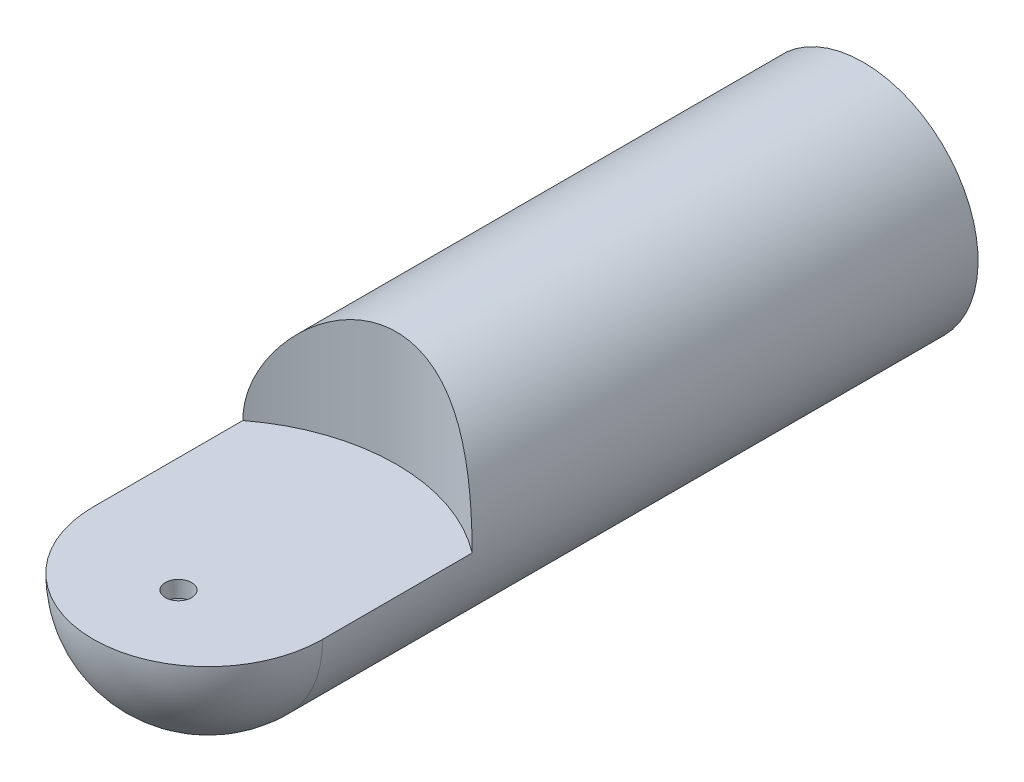
from build123d import *

# Parameters (mm, degrees)
REVOLVE1_ANGLE      = 90
SHELL2_T            = -5
SKETCH3_R           = 4
CUT_EXTRUDE1_DEPTH  = 7
SKETCH4_R           = 35
SKETCH4_R_2         = 30
BOSS_EXTRUDE1_DEPTH = 200
BOSS_EXTRUDE3_REACH = 208.034
CUT_EXTRUDE3_DEPTH  = 80
SKETCH6_W           = 60
SKETCH6_H           = 5
BOSS_EXTRUDE4_DEPTH = 60
CUT_EXTRUDE4_DEPTH  = 113
BOSS_EXTRUDE5_REACH = 208.034


with BuildPart() as part:
    # Sketch1 → Revolve1 (revolve)
    with BuildSketch(Plane(origin=(0, 0, 0), x_dir=(1, 0, 0), z_dir=(0, 1, 0))):
        with BuildLine():
            Line((-35, 0), (35, 0))
            ThreePointArc((35, 0), (0, -35), (-35, 0))
        make_face()
    revolve(axis=Axis((-35, 0, 0), (1, 0, 0)), revolution_arc=REVOLVE1_ANGLE)

    # Shell2
    shell2_openings = [part.faces().sort_by_distance(p)[0] for p in [
        (0, -14.854461355, 0),
    ]]
    offset(amount=SHELL2_T, openings=shell2_openings, kind=Kind.INTERSECTION)

    # Sketch3 → Cut-Extrude1 (cut)
    with BuildSketch(Plane(origin=(0, 0, 0), x_dir=(1, 0, 0), z_dir=(0, 1, 0))):
        with Locations(Location((0, -9, 0), (0, 0, 270))):
            Circle(SKETCH3_R)
    extrude(amount=-CUT_EXTRUDE1_DEPTH, mode=Mode.SUBTRACT)

    # Sketch4 → Boss-Extrude1 (add)
    with BuildSketch(Plane(origin=(0, 0, 0), x_dir=(-1, 0, 0), z_dir=(0, 0, -1))):
        Circle(SKETCH4_R)
        with Locations(Location((0, 0, 0), (0, 0, 189.594068227))):
            Circle(SKETCH4_R_2, mode=Mode.SUBTRACT)
    extrude(amount=BOSS_EXTRUDE1_DEPTH)

    # Sketch5 → Boss-Extrude3 (add, up to next)
    with BuildSketch(Plane(origin=(0, 0, 0), x_dir=(1, 0, 0), z_dir=(0, 1, 0)), mode=Mode.PRIVATE) as boss_extrude3_sk1:
        with BuildLine():
            ThreePointArc((-30, 0), (0, 30), (30, 0))
            Line((30, 0), (35, 0))
            ThreePointArc((35, 0), (0, 35), (-35, 0))
            Line((-35, 0), (-30, 0))
        make_face()
    boss_extrude3_tool1 = extrude(boss_extrude3_sk1.sketch, amount=BOSS_EXTRUDE3_REACH, mode=Mode.PRIVATE) - part.part
    add(boss_extrude3_tool1.solids().sort_by_distance((-32.5, 0, -0.782624))[0])

    # Sketch5<5> → Cut-Extrude3 (cut)
    with BuildSketch(Plane(origin=(0, 0, 0), x_dir=(1, 0, 0), z_dir=(0, 1, 0))):
        with BuildLine():
            ThreePointArc((30, 0), (0, 30), (-30, 0))
            Line((-30, 0), (30, 0))
        make_face()
        with BuildLine():
            Line((30, 0), (-30, 0))
            ThreePointArc((-30, 0), (0, -30), (30, 0))
        make_face()
    extrude(amount=CUT_EXTRUDE3_DEPTH, mode=Mode.SUBTRACT)

    # Sketch6 → Boss-Extrude4 (add)
    with BuildSketch(Plane(origin=(0, 0, 0), x_dir=(-1, 0, 0), z_dir=(0, 0, -1))):
        with Locations((0, -2.5)):
            Rectangle(SKETCH6_W, SKETCH6_H)
    extrude(amount=BOSS_EXTRUDE4_DEPTH)

    # Sketch5<7> → Cut-Extrude4 (cut)
    with BuildSketch(Plane(origin=(0, 0, 0), x_dir=(1, 0, 0), z_dir=(0, 1, 0))):
        with BuildLine():
            ThreePointArc((35, 0), (0, 35), (-35, 0))
            Line((-35, 0), (-30, 0))
            ThreePointArc((-30, 0), (0, 30), (30, 0))
            Line((30, 0), (35, 0))
        make_face()
        with BuildLine():
            Line((-30, 0), (-35, 0))
            ThreePointArc((-35, 0), (0, -35), (35, 0))
            Line((35, 0), (30, 0))
            ThreePointArc((30, 0), (0, -30), (-30, 0))
        make_face()
        with BuildLine():
            Line((-35, 45.620718977), (-35, 0))
            ThreePointArc((-35, 0), (0, 35), (35, 0))
            Line((35, 0), (35, 45.620718977))
            Line((35, 45.620718977), (-35, 45.620718977))
        make_face()
        with BuildLine():
            ThreePointArc((35, 45.620718977), (0, 57.5), (-35, 45.620718977))
            Line((-35, 45.620718977), (35, 45.620718977))
        make_face()
    extrude(amount=CUT_EXTRUDE4_DEPTH, mode=Mode.SUBTRACT)

    # Sketch5<9> → Boss-Extrude5 (add, up to next)
    with BuildSketch(Plane(origin=(0, 0, 0), x_dir=(1, 0, 0), z_dir=(0, 1, 0)), mode=Mode.PRIVATE) as boss_extrude5_sk1:
        with BuildLine():
            ThreePointArc((-35, 45.620718977), (0, 57.5), (35, 45.620718977))
            Line((35, 45.620718977), (35, 48.733971724))
            ThreePointArc((35, 48.733971724), (0, 60), (-35, 48.733971724))
            Line((-35, 48.733971724), (-35, 45.620718977))
        make_face()
    boss_extrude5_tool1 = extrude(boss_extrude5_sk1.sketch, amount=BOSS_EXTRUDE5_REACH, mode=Mode.PRIVATE) - part.part
    add(boss_extrude5_tool1.solids().sort_by_distance((0, 0, -59.285384))[0])


solid = part.part
